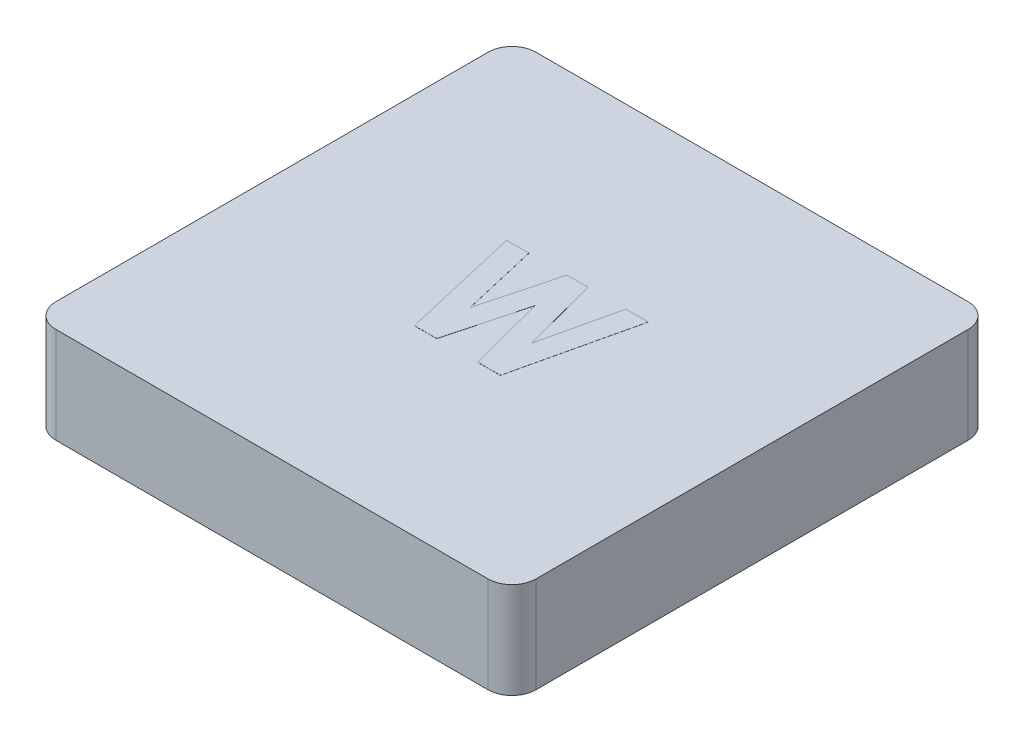
from build123d import *

# Parameters (mm, degrees)
SKETCH1_W           = 12.7
SKETCH1_H           = 12.7
BOSS_EXTRUDE1_DEPTH = 2.54
FILLET1_R           = 0.635
SHELL1_START        = 0.635
SHELL1_OUTLINE_W    = 1.905
SHELL1_OUTLINE_H    = 11.43
SHELL1_DEPTH        = 11.43
SKETCH2_R           = 2.54
BOSS_EXTRUDE2_DEPTH = 1.905
BOSS_EXTRUDE3_DEPTH = 0.00254


# Read off the part's stored shape, not the designer's step: Shell1
with BuildPart() as part:
    # Sketch1 → Boss-Extrude1 (new body)
    with BuildSketch(Plane(origin=(0, 0, 0), x_dir=(1, 0, 0), z_dir=(0, 1, 0))):
        with Locations((6.35, 6.35)):
            Rectangle(SKETCH1_W, SKETCH1_H)
    extrude(amount=BOSS_EXTRUDE1_DEPTH)

    # Fillet1
    fillet1_edges = [part.edges().sort_by_distance(p)[0] for p in [
        (0, 1.27, -12.7),
        (12.7, 1.27, -12.7),
        (12.7, 1.27, 0),
        (0, 1.27, 0),
    ]]
    fillet(fillet1_edges, radius=FILLET1_R)

    # Shell1 outline → Shell1 (cut)
    with BuildSketch(Plane.YZ.offset(SHELL1_START)):
        with Locations((0.9525, -6.35)):
            Rectangle(SHELL1_OUTLINE_W, SHELL1_OUTLINE_H)
    extrude(amount=SHELL1_DEPTH, mode=Mode.SUBTRACT)

    # Sketch2 → Boss-Extrude2 (add)
    with BuildSketch(Plane(origin=(0, 1.905, 0), x_dir=(-1, 0, 0), z_dir=(0, -1, 0))):
        with Locations(Location((-6.35, 6.35, 0), (0, 0, 270))):
            Circle(SKETCH2_R)
    extrude(amount=BOSS_EXTRUDE2_DEPTH)

    # Sketch3 → Boss-Extrude3 (add)
    with BuildSketch(Plane(origin=(0, 2.54, 0), x_dir=(1, 0, 0), z_dir=(0, 1, 0))):
        Polygon((4.556857692, 8.001), (5.145173998, 8.001), (5.615191026, 5.974011819), (6.153897957, 8.001), (6.707869311, 8.001), (7.243396154, 5.974011819), (7.712141146, 8.001), (8.301729487, 8.001), (7.567129127, 4.826), (6.971816627, 4.826), (6.42929359, 6.878428886), (5.883590465, 4.826), (5.292730088, 4.826), align=None)
    extrude(amount=BOSS_EXTRUDE3_DEPTH)


solid = part.part
